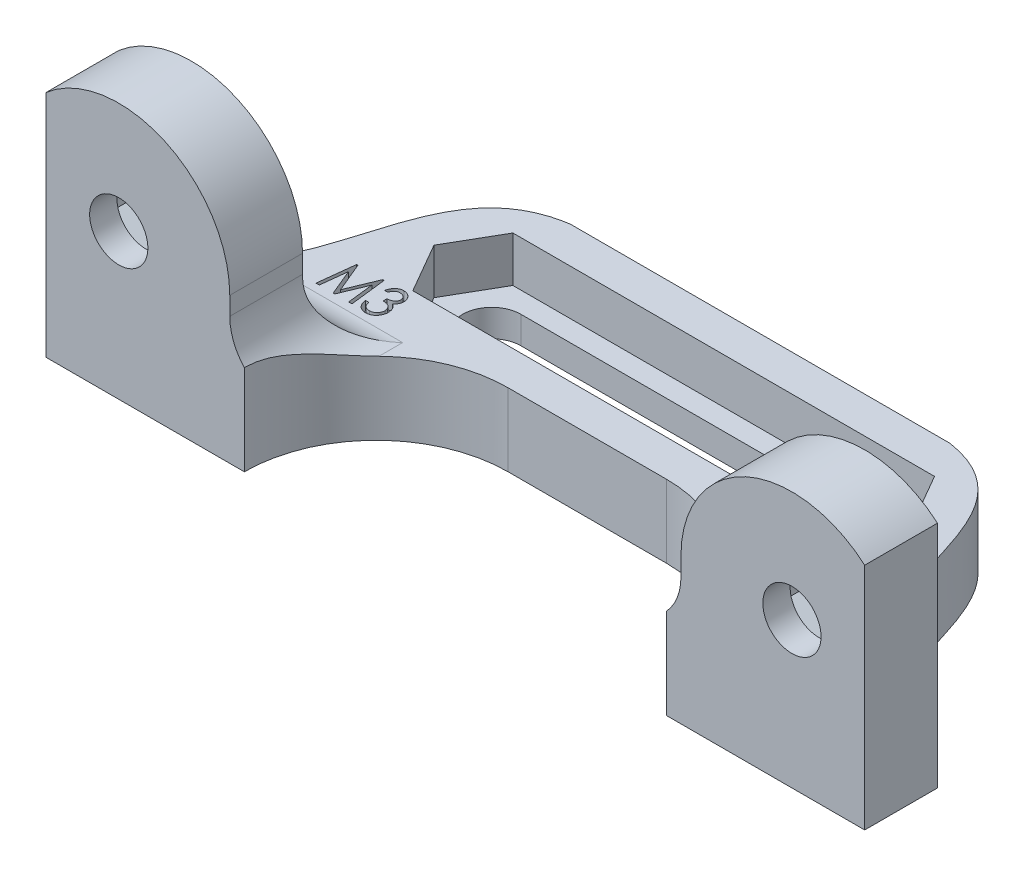
from build123d import *

# Parameters (mm, degrees)
BOSS_EXTRUDE1_DEPTH       = 22.5
SKETCH4_R                 = 1.6
HOLE_SHARP_DEPTH          = 34.634060118
POCKET_SHARPNUTS_DEPTH    = 2.5
HOLE_MOUNT_DEPTH          = 34.634060118
SLOT_NUTS_START           = 4
SLOT_NUTS_DEPTH           = 2.5
FILL_STIFFENER_R          = 2.5
BOARD_CONTOUR_DEPTH       = 34.634060118
BOARD_INNERCOUNTOUR_DEPTH = 32.809000422
SHARP_CUTOUT_DEPTH        = 32.809000469
SIZE_M3_DEPTH             = 0.5


with BuildPart() as part:
    # Sketch1 → Boss-Extrude1 (new, symmetric)
    with BuildSketch(Plane(origin=(0, 0, 0), x_dir=(0, 0, -1), z_dir=(1, 0, 0))):
        Polygon((0, 15), (0, 0), (20, 0), (20, 4), (4, 4), (4, 15), align=None)
    extrude(amount=BOSS_EXTRUDE1_DEPTH, both=True)

    # Sketch4 → Hole-Sharp (cut, through all)
    with BuildSketch(Plane.XY):
        with Locations((-18.5, 8)):
            Circle(SKETCH4_R)
        with Locations((18.5, 8)):
            Circle(SKETCH4_R)
    extrude(amount=-HOLE_SHARP_DEPTH, mode=Mode.SUBTRACT)

    # Sketch5 → Pocket-SharpNuts (cut)
    with BuildSketch(Plane(origin=(0, 0, -4), x_dir=(-1, 0, 0), z_dir=(0, 0, -1))):
        Polygon((-15.75, 6.41228676), (-15.75, 9.58771324), (-18.5, 11.175426481), (-21.25, 9.58771324), (-21.25, 6.41228676), (-18.5, 4.824573519), align=None)
        Polygon((18.5, 4.824573519), (21.25, 6.41228676), (21.25, 9.58771324), (18.5, 11.175426481), (15.75, 9.58771324), (15.75, 6.41228676), align=None)
    extrude(amount=-POCKET_SHARPNUTS_DEPTH, mode=Mode.SUBTRACT)

    # Sketch8 → Hole-mount (cut, through all)
    with BuildSketch(Plane(origin=(0, 0, 0), x_dir=(1, 0, 0), z_dir=(0, 1, 0))):
        with BuildLine():
            Line((-10, 13.6), (10, 13.6))
            ThreePointArc((10, 13.6), (11.6, 12), (10, 10.4))
            Line((10, 10.4), (-10, 10.4))
            ThreePointArc((-10, 10.4), (-11.6, 12), (-10, 13.6))
        make_face()
    extrude(amount=HOLE_MOUNT_DEPTH, mode=Mode.SUBTRACT)

    # Sketch6 → Slot-Nuts (cut)
    with BuildSketch(Plane(origin=(0, 0, 0), x_dir=(1, 0, 0), z_dir=(0, 1, 0)).offset(SLOT_NUTS_START)):
        Polygon((-8.41228676, 14.75), (-11.58771324, 14.75), (-13.175426481, 12), (-11.58771324, 9.25), (-8.41228676, 9.25), (8.41228676, 9.25), (11.58771324, 9.25), (13.175426481, 12), (11.58771324, 14.75), (8.41228676, 14.75), align=None)
    extrude(amount=-SLOT_NUTS_DEPTH, mode=Mode.SUBTRACT)

    # fill-stiffener
    # the kernel refuses this fillet: 2.5 mm, written as the material it adds along each edge
    with BuildSketch(Plane(origin=(22.5, 4, -4), x_dir=(0, 0, -1), z_dir=(-1, 0, 0))) as fill_stiffener_piece_1_section:
        with BuildLine():
            CenterArc((FILL_STIFFENER_R, -FILL_STIFFENER_R), FILL_STIFFENER_R, 90, 90)
            Line((0, -FILL_STIFFENER_R), (0, 0))
            Line((0, 0), (FILL_STIFFENER_R, 0))
        make_face()
    fill_stiffener_piece_1 = extrude(amount=51.25, mode=Mode.PRIVATE)
    fill_stiffener_piece_1 = split(fill_stiffener_piece_1, bisect_by=Plane(origin=(20.9160017, 6.219452752, -4.558420416), z_dir=(0.5000000000000003, -0.8660254037844385, 0)), keep=Keep.TOP, mode=Mode.PRIVATE)
    add(fill_stiffener_piece_1)
    with BuildSketch(Plane(origin=(28.75, 4, -4), x_dir=(0, 0, -1), z_dir=(-1, 0, 0))) as fill_stiffener_piece_2_section:
        with BuildLine():
            CenterArc((FILL_STIFFENER_R, -FILL_STIFFENER_R), FILL_STIFFENER_R, 90, 90)
            Line((0, -FILL_STIFFENER_R), (0, 0))
            Line((0, 0), (FILL_STIFFENER_R, 0))
        make_face()
    fill_stiffener_piece_2 = extrude(amount=57.5, mode=Mode.PRIVATE)
    fill_stiffener_piece_2 = split(fill_stiffener_piece_2, bisect_by=Plane(origin=(21.25, 6.447370821, -4.000307808), z_dir=(1, 0, 0)), keep=Keep.TOP, mode=Mode.PRIVATE)
    fill_stiffener_piece_2 = split(fill_stiffener_piece_2, bisect_by=Plane(origin=(21.287979611, 6.434214298, -4.000307808), z_dir=(-0.5000000000000003, 0.8660254037844385, 0)), keep=Keep.TOP, mode=Mode.PRIVATE)
    add(fill_stiffener_piece_2)
    with BuildSketch(Plane(origin=(28.75, 4, -4), x_dir=(0, 0, -1), z_dir=(-1, 0, 0))) as fill_stiffener_piece_3_section:
        with BuildLine():
            CenterArc((FILL_STIFFENER_R, -FILL_STIFFENER_R), FILL_STIFFENER_R, 90, 90)
            Line((0, -FILL_STIFFENER_R), (0, 0))
            Line((0, 0), (FILL_STIFFENER_R, 0))
        make_face()
    fill_stiffener_piece_3 = extrude(amount=57.5, mode=Mode.PRIVATE)
    fill_stiffener_piece_3 = split(fill_stiffener_piece_3, bisect_by=Plane(origin=(7.867404078, 20.047801362, -4.000307808), z_dir=(0.49999999999999956, -0.8660254037844389, 0)), keep=Keep.TOP, mode=Mode.PRIVATE)
    fill_stiffener_piece_3 = split(fill_stiffener_piece_3, bisect_by=Plane(origin=(15.75, 6.447370821, -4.000307808), z_dir=(-1, 0, 0)), keep=Keep.TOP, mode=Mode.PRIVATE)
    add(fill_stiffener_piece_3)
    with BuildSketch(Plane(origin=(28.75, 4, -4), x_dir=(0, 0, -1), z_dir=(-1, 0, 0))) as fill_stiffener_piece_4_section:
        with BuildLine():
            CenterArc((FILL_STIFFENER_R, -FILL_STIFFENER_R), FILL_STIFFENER_R, 90, 90)
            Line((0, -FILL_STIFFENER_R), (0, 0))
            Line((0, 0), (FILL_STIFFENER_R, 0))
        make_face()
    fill_stiffener_piece_4 = extrude(amount=57.5, mode=Mode.PRIVATE)
    fill_stiffener_piece_4 = split(fill_stiffener_piece_4, bisect_by=Plane(origin=(-15.75, 4.584439614, -4.52300439), z_dir=(1, 0, 0)), keep=Keep.TOP, mode=Mode.PRIVATE)
    fill_stiffener_piece_4 = split(fill_stiffener_piece_4, bisect_by=Plane(origin=(17.305544853, 5.51419252, -4.52300439), z_dir=(-0.5000000000000003, -0.8660254037844385, 0)), keep=Keep.TOP, mode=Mode.PRIVATE)
    add(fill_stiffener_piece_4)
    with BuildSketch(Plane(origin=(28.75, 4, -4), x_dir=(0, 0, -1), z_dir=(-1, 0, 0))) as fill_stiffener_piece_5_section:
        with BuildLine():
            CenterArc((FILL_STIFFENER_R, -FILL_STIFFENER_R), FILL_STIFFENER_R, 90, 90)
            Line((0, -FILL_STIFFENER_R), (0, 0))
            Line((0, 0), (FILL_STIFFENER_R, 0))
        make_face()
    fill_stiffener_piece_5 = extrude(amount=51.25, mode=Mode.PRIVATE)
    fill_stiffener_piece_5 = split(fill_stiffener_piece_5, bisect_by=Plane(origin=(-21.25, 6.447370821, -4.000307808), z_dir=(-1, 0, 0)), keep=Keep.TOP, mode=Mode.PRIVATE)
    add(fill_stiffener_piece_5)
    with BuildSketch(Plane(origin=(28.75, 4, -4), x_dir=(0, 0, -1), z_dir=(-1, 0, 0))) as fill_stiffener_piece_6_section:
        with BuildLine():
            CenterArc((FILL_STIFFENER_R, -FILL_STIFFENER_R), FILL_STIFFENER_R, 90, 90)
            Line((0, -FILL_STIFFENER_R), (0, 0))
            Line((0, 0), (FILL_STIFFENER_R, 0))
        make_face()
    fill_stiffener_piece_6 = extrude(amount=57.5, mode=Mode.PRIVATE)
    fill_stiffener_piece_6 = split(fill_stiffener_piece_6, bisect_by=Plane(origin=(-19.694455147, 5.51419252, -4.52300439), z_dir=(-0.5000000000000002, -0.8660254037844386, 0)), keep=Keep.TOP, mode=Mode.PRIVATE)
    fill_stiffener_piece_6 = split(fill_stiffener_piece_6, bisect_by=Plane(origin=(-21.25, 4.584439614, -4.52300439), z_dir=(1, 0, 0)), keep=Keep.TOP, mode=Mode.PRIVATE)
    add(fill_stiffener_piece_6)

    # Sketch10 → board-contour (cut, through all)
    with BuildSketch(Plane(origin=(0, 0, 0), x_dir=(1, 0, 0), z_dir=(0, 1, 0))):
        with BuildLine():
            Line((-10.433012702, 16.75), (10.433012702, 16.75))
            add(Edge.make_bspline(
                [(22.5, 4), (13.297125736, 4.28485416), (17.940093345, 15.612477618), (10.433012702, 16.75)],
                knots=[0, 0, 0, 0, 1, 1, 1, 1], degree=3))
            Line((22.5, 4), (22.5, 20))
            Line((22.5, 20), (-22.5, 20))
            Line((-22.5, 20), (-22.5, 4))
            add(Edge.make_bspline(
                [(-22.5, 4), (-13.297125736, 4.28485416), (-17.940093345, 15.612477618), (-10.433012702, 16.75)],
                knots=[0, 0, 0, 0, 1, 1, 1, 1], degree=3))
        make_face()
    extrude(amount=BOARD_CONTOUR_DEPTH, mode=Mode.SUBTRACT)

    # Sketch11 → board-innercountour (cut, through all)
    with BuildSketch(Plane(origin=(0, 0, 0), x_dir=(1, 0, 0), z_dir=(0, 1, 0))):
        with BuildLine():
            Line((11.6, 0), (-11.6, 0))
            ThreePointArc((-11.6, 0), (-9.476524164, 5.126524164), (-4.35, 7.25))
            Line((-4.35, 7.25), (4.35, 7.25))
            ThreePointArc((4.35, 7.25), (9.476524164, 5.126524164), (11.6, 0))
        make_face()
    extrude(amount=BOARD_INNERCOUNTOUR_DEPTH, mode=Mode.SUBTRACT)

    # Sketch14 → sharp-cutout (cut, through all)
    with BuildSketch(Plane.XY):
        with BuildLine():
            Line((-22.5, 12.605431576), (-22.5, 15))
            Line((-22.5, 15), (22.5, 15))
            Line((22.5, 15), (22.5, 12.605431576))
            ThreePointArc((22.5, 12.605431576), (15.969189853, 13.550225221), (12.4, 8))
            Line((12.4, 8), (12.4, 7))
            ThreePointArc((12.4, 7), (11.521320344, 4.878679656), (9.4, 4))
            Line((9.4, 4), (-9.4, 4))
            ThreePointArc((-9.4, 4), (-11.521320344, 4.878679656), (-12.4, 7))
            Line((-12.4, 7), (-12.4, 8))
            ThreePointArc((-12.4, 8), (-15.969189853, 13.550225221), (-22.5, 12.605431576))
        make_face()
    extrude(amount=-SHARP_CUTOUT_DEPTH, mode=Mode.SUBTRACT)

    # Sketch15 → size-M3 (cut)
    with BuildSketch(Plane(origin=(0, 4, 0), x_dir=(1, 0, 0), z_dir=(0, 1, 0))):
        Polygon((-14.610812689, 6.952400345), (-14.38084474, 8.952400345), (-14.308328715, 8.952400345), (-13.623633202, 7.311374704), (-12.942142817, 8.952400345), (-12.867222946, 8.952400345), (-12.636453715, 6.952400345), (-12.816341535, 6.952400345), (-12.982607561, 8.388297781), (-13.578761407, 6.952400345), (-13.665299869, 6.952400345), (-14.264658843, 8.388297781), (-14.429722946, 6.952400345), align=None)
        with BuildLine():
            Line((-12.200556279, 8.490861884), (-12.380043458, 8.490861884))
            add(Edge.make_bspline(
                [(-12.380043458, 8.490861884), (-12.375495519, 8.510960435), (-12.366629743, 8.550140652), (-12.349237064, 8.606643346), (-12.328864673, 8.659517355), (-12.305603196, 8.70894341), (-12.279638487, 8.754964362), (-12.250078292, 8.797070514), (-12.218291191, 8.836286287), (-12.182718021, 8.870851892), (-12.145696636, 8.90241693), (-12.106226865, 8.929079907), (-12.065497127, 8.952285287), (-12.022984405, 8.971171424), (-11.978631638, 8.985581226), (-11.932643549, 8.99599565), (-11.885046105, 9.002651922), (-11.852688243, 9.003336989), (-11.836373587, 9.003682397)],
                knots=[0, 0, 0, 0, 1.213646873, 2.365889363, 3.479226314, 4.54912843, 5.581579656, 6.587705624, 7.576924878, 8.55050232, 9.505464024, 10.439453725, 11.351887816, 12.264152294, 13.174752891, 14.094686289, 15.039351257, 16, 16, 16, 16], degree=3))
            add(Edge.make_bspline(
                [(-11.836373587, 9.003682397), (-11.812534826, 9.002886779), (-11.765259828, 9.001308977), (-11.695880367, 8.987094629), (-11.629013407, 8.964418812), (-11.565341737, 8.933307182), (-11.50619186, 8.894764333), (-11.453542923, 8.849120836), (-11.408323364, 8.796982793), (-11.370846871, 8.739224636), (-11.341008823, 8.677921968), (-11.319063794, 8.614634949), (-11.305730442, 8.549778354), (-11.303992524, 8.50601355), (-11.303120382, 8.484050986)],
                knots=[0, 0, 0, 0, 1.037475548, 2.057433109, 3.071083532, 4.106583696, 5.136003477, 6.138035553, 7.131860785, 8.132253496, 9.128731291, 10.094580144, 11.043800018, 12, 12, 12, 12], degree=3))
            add(Edge.make_bspline(
                [(-11.303120382, 8.484050986), (-11.303812117, 8.462906619), (-11.305164971, 8.421553769), (-11.315811533, 8.361210982), (-11.333463012, 8.304200262), (-11.358513028, 8.250631058), (-11.390524552, 8.200356554), (-11.429736599, 8.153824099), (-11.475775563, 8.110376624), (-11.51073235, 8.08541134), (-11.528681279, 8.072592653)],
                knots=[0, 0, 0, 0, 1.034740432, 2.023681557, 2.989439786, 3.948891607, 4.910213012, 5.898894732, 6.921165452, 8, 8, 8, 8], degree=3))
            add(Edge.make_bspline(
                [(-11.528681279, 8.072592653), (-11.509540126, 8.062271428), (-11.471329258, 8.041667497), (-11.419555664, 8.0018386), (-11.372717648, 7.955511909), (-11.346728601, 7.919934251), (-11.333569099, 7.901919576)],
                knots=[0, 0, 0, 0, 0.994457701, 1.985203988, 2.979812114, 4, 4, 4, 4], degree=3))
            add(Edge.make_bspline(
                [(-11.333569099, 7.901919576), (-11.324903762, 7.888713502), (-11.30764691, 7.862413862), (-11.28638628, 7.820566598), (-11.267642052, 7.777852089), (-11.252468675, 7.733915865), (-11.240832943, 7.688739015), (-11.232443792, 7.642415733), (-11.227008107, 7.594891273), (-11.226468586, 7.562724895), (-11.226197305, 7.546550986)],
                knots=[0, 0, 0, 0, 1.00515716, 2.001751025, 2.984458985, 3.97420733, 4.958128942, 5.952324961, 6.970387383, 8, 8, 8, 8], degree=3))
            add(Edge.make_bspline(
                [(-11.226197305, 7.546550986), (-11.22726489, 7.518580124), (-11.229389478, 7.462915656), (-11.244530086, 7.380265809), (-11.270550777, 7.300010583), (-11.305555526, 7.222601884), (-11.349091526, 7.150506127), (-11.400849781, 7.085971404), (-11.460163867, 7.030212539), (-11.526495189, 6.983763582), (-11.598336233, 6.946484725), (-11.675287062, 6.92071752), (-11.756177699, 6.903801639), (-11.81171391, 6.902023359), (-11.839979356, 6.901118294)],
                knots=[0, 0, 0, 0, 1.014707837, 2.019357588, 3.036907717, 4.069166202, 5.095504868, 6.084608755, 7.061626644, 8.038980938, 9.014218756, 9.987287233, 10.975619287, 12, 12, 12, 12], degree=3))
            add(Edge.make_bspline(
                [(-11.839979356, 6.901118294), (-11.858960124, 6.901611107), (-11.896244796, 6.902579158), (-11.951054595, 6.909287041), (-12.00328941, 6.921506184), (-12.053214848, 6.937910141), (-12.100885001, 6.958902909), (-12.146250672, 6.984480859), (-12.188976257, 7.015252846), (-12.229016681, 7.0506137), (-12.266439358, 7.090242762), (-12.300146016, 7.134714113), (-12.330648181, 7.183411451), (-12.357868718, 7.236342333), (-12.381563912, 7.293738274), (-12.401855715, 7.355338591), (-12.418815957, 7.421476521), (-12.42707696, 7.467296918), (-12.43132551, 7.490861884)],
                knots=[0, 0, 0, 0, 0.990513423, 1.945704551, 2.875515556, 3.785713825, 4.684393021, 5.589454026, 6.498450854, 7.426798081, 8.373433753, 9.338011181, 10.333830724, 11.368661367, 12.440314751, 13.570898844, 14.750737914, 16, 16, 16, 16], degree=3))
            Line((-12.43132551, 7.490861884), (-12.25183833, 7.490861884))
            add(Edge.make_bspline(
                [(-12.25183833, 7.490861884), (-12.248022799, 7.475449483), (-12.240602873, 7.445477546), (-12.226648446, 7.402744776), (-12.21264486, 7.36289752), (-12.196425992, 7.326743044), (-12.179259655, 7.293767466), (-12.160849791, 7.263891576), (-12.141008484, 7.237429955), (-12.12631406, 7.221907089), (-12.119226151, 7.214419576)],
                knots=[0, 0, 0, 0, 1.227409514, 2.386898646, 3.474821375, 4.49196229, 5.448190758, 6.348047463, 7.203174547, 8, 8, 8, 8], degree=3))
            add(Edge.make_bspline(
                [(-12.119226151, 7.214419576), (-12.109770517, 7.205812025), (-12.091042851, 7.188764056), (-12.060250403, 7.166703472), (-12.027877926, 7.147516833), (-11.99300127, 7.133070653), (-11.95686795, 7.12062325), (-11.918520356, 7.112503238), (-11.878334872, 7.106993295), (-11.850816415, 7.106498821), (-11.836774228, 7.106246499)],
                knots=[0, 0, 0, 0, 0.987786239, 1.956392453, 2.923291289, 3.889914458, 4.869410071, 5.873943724, 6.915110651, 8, 8, 8, 8], degree=3))
            add(Edge.make_bspline(
                [(-11.836774228, 7.106246499), (-11.820857442, 7.106589669), (-11.789839723, 7.107258417), (-11.74458181, 7.113687821), (-11.701563732, 7.122784236), (-11.661238439, 7.137323394), (-11.622806096, 7.154691771), (-11.587212994, 7.176918101), (-11.55397352, 7.202898857), (-11.523370881, 7.232310285), (-11.4960403, 7.264621773), (-11.471887728, 7.298365547), (-11.451090694, 7.333315729), (-11.434915301, 7.37007704), (-11.421312798, 7.407832284), (-11.412196645, 7.447229493), (-11.407013782, 7.48791848), (-11.406130851, 7.515419982), (-11.405684484, 7.529323422)],
                knots=[0, 0, 0, 0, 1.131388683, 2.204785482, 3.246441662, 4.252851856, 5.247356788, 6.241181003, 7.22926868, 8.243715995, 9.254465245, 10.235036049, 11.192984918, 12.141087045, 13.087426855, 14.043631555, 15.010953923, 16, 16, 16, 16], degree=3))
            add(Edge.make_bspline(
                [(-11.405684484, 7.529323422), (-11.406367544, 7.547939583), (-11.407725732, 7.584955721), (-11.418969614, 7.639414636), (-11.437076331, 7.69197762), (-11.462406603, 7.74180841), (-11.493278013, 7.787994613), (-11.529501909, 7.829099113), (-11.571364382, 7.863330399), (-11.610187963, 7.887139487), (-11.644690976, 7.902985197), (-11.673977174, 7.913860957), (-11.706660155, 7.922766393), (-11.742415298, 7.93134882), (-11.781751454, 7.938435392), (-11.824396587, 7.944325207), (-11.870357857, 7.949209009), (-11.902069525, 7.951310953), (-11.918504997, 7.952400345)],
                knots=[0, 0, 0, 0, 1.19277501, 2.371698767, 3.54972029, 4.748382554, 5.945391955, 7.103829679, 8.24739154, 9.400245482, 10.013276171, 10.679775806, 11.400814213, 12.18386578, 13.037095876, 13.962316118, 14.943912534, 16, 16, 16, 16], degree=3))
            Line((-11.918504997, 7.952400345), (-11.918504997, 8.157528551))
            add(Edge.make_bspline(
                [(-11.918504997, 8.157528551), (-11.897496388, 8.157959987), (-11.856201428, 8.158808028), (-11.796036421, 8.168660066), (-11.738356653, 8.182710723), (-11.684642037, 8.203547433), (-11.635659108, 8.228364026), (-11.593067124, 8.256674642), (-11.55796386, 8.288752828), (-11.529957736, 8.323999764), (-11.50869405, 8.361716405), (-11.493758817, 8.401331913), (-11.483968816, 8.442441116), (-11.483063703, 8.470640752), (-11.482607561, 8.484852269)],
                knots=[0, 0, 0, 0, 1.243740816, 2.444722913, 3.604071008, 4.756374622, 5.850061341, 6.853181308, 7.777365241, 8.656145985, 9.510167359, 10.331781837, 11.159283104, 12, 12, 12, 12], degree=3))
            add(Edge.make_bspline(
                [(-11.482607561, 8.484852269), (-11.482907083, 8.495288212), (-11.483501676, 8.516004974), (-11.488488564, 8.546334253), (-11.496193573, 8.575737511), (-11.50683949, 8.604065185), (-11.521207649, 8.631207429), (-11.538415054, 8.657324727), (-11.559002835, 8.682134119), (-11.582249426, 8.705639902), (-11.607467186, 8.727748333), (-11.635305363, 8.746357832), (-11.664395872, 8.762717999), (-11.695158176, 8.775856449), (-11.727661185, 8.785967777), (-11.76174154, 8.79306946), (-11.797524997, 8.797593988), (-11.821936816, 8.798230169), (-11.834370382, 8.798554192)],
                knots=[0, 0, 0, 0, 0.954298075, 1.894410913, 2.804261135, 3.732387345, 4.655998667, 5.60826082, 6.589174048, 7.600068601, 8.631142096, 9.651225118, 10.65760524, 11.681194716, 12.705294547, 13.766901717, 14.862625692, 16, 16, 16, 16], degree=3))
            add(Edge.make_bspline(
                [(-11.834370382, 8.798554192), (-11.854349024, 8.797760735), (-11.893431516, 8.796208564), (-11.949733801, 8.782476455), (-12.002047671, 8.760699069), (-12.041796249, 8.73479919), (-12.070954884, 8.709197013), (-12.092244391, 8.6871742), (-12.112443092, 8.661850522), (-12.131962393, 8.633664188), (-12.150205005, 8.602074973), (-12.168486665, 8.568101844), (-12.185206875, 8.530648246), (-12.195334243, 8.504397642), (-12.200556279, 8.490861884)],
                knots=[0, 0, 0, 0, 1.395445339, 2.729789254, 4.027341734, 5.343352216, 6.025171276, 6.738565338, 7.482488129, 8.288221053, 9.133992859, 10.032284056, 10.985374711, 12, 12, 12, 12], degree=3))
        make_face()
    extrude(amount=-SIZE_M3_DEPTH, mode=Mode.SUBTRACT)


solid = part.part
